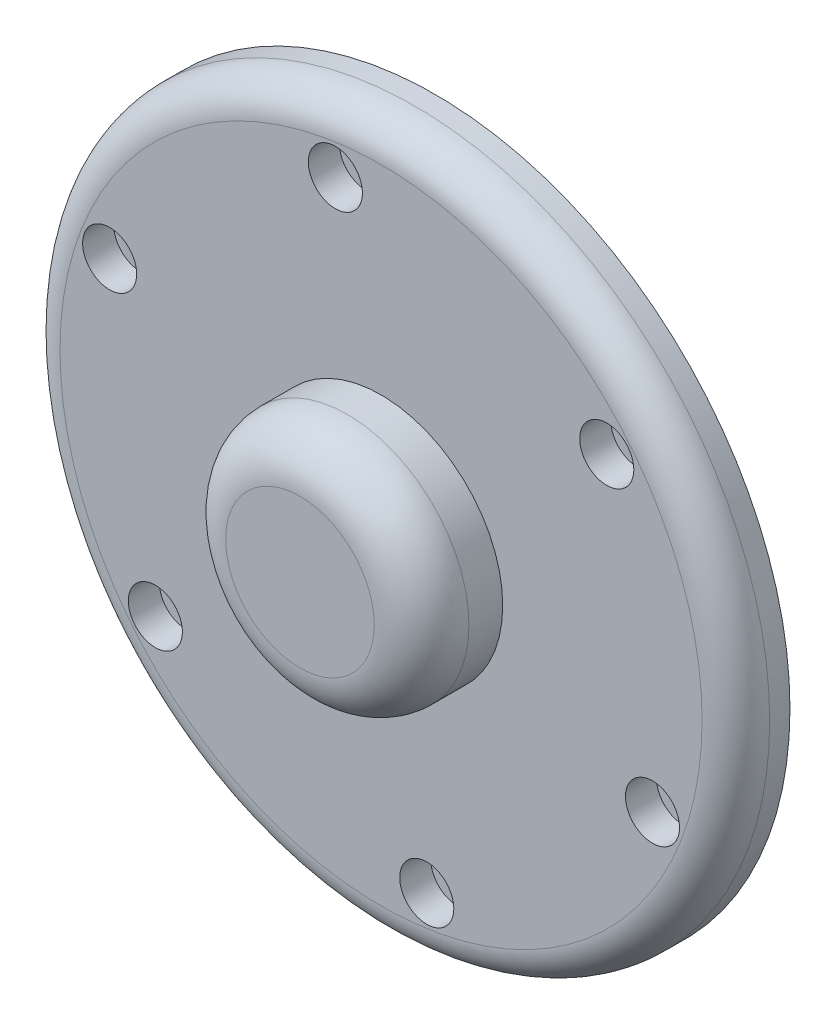
from build123d import *

# Parameters (mm, degrees)
SKETCH_1_R                   = 52.5
EXTRUDE_1_DEPTH              = 20
CUT_EXTRUDE_START            = -12
SKETCH_3_R                   = 52.5
SKETCH_3_R_2                 = 18
CUT_EXTRUDE_1_DEPTH          = 12
SKETCH_5_R                   = 15.25
CUT_EXTRUDE_3_DEPTH          = 17.5
HOLE_WIZARD_M4_1_D           = 4.5
HOLE_WIZARD_M4_1_CBORE_D     = 8
HOLE_WIZARD_M4_1_CBORE_DEPTH = 4.6
PATTERN_CIRCULAR_1_COUNT     = 6
FILLET_2_R                   = 7
FILLET_3_R                   = 5


with BuildPart() as part:
    # 草图1 → 凸台-拉伸1 (new body)
    with BuildSketch(Plane.XY):
        Circle(SKETCH_1_R)
    extrude(amount=EXTRUDE_1_DEPTH)

    # 草图3 → 切除-拉伸1 (cut)
    with BuildSketch(Plane.XY.offset(20).offset(CUT_EXTRUDE_START)):
        Circle(SKETCH_3_R)
        Circle(SKETCH_3_R_2, mode=Mode.SUBTRACT)
    extrude(amount=CUT_EXTRUDE_1_DEPTH, mode=Mode.SUBTRACT)

    # 草图5 → 切除-拉伸3 (cut)
    with BuildSketch(Plane(origin=(0, 0, 0), x_dir=(-1, 0, 0), z_dir=(0, 0, -1))):
        with Locations((0, 0.647267044)):
            Circle(SKETCH_5_R)
    extrude(amount=-CUT_EXTRUDE_3_DEPTH, mode=Mode.SUBTRACT)

    # M4 六角圆柱头螺钉的柱形沉头孔1 (through all)
    with Locations(Plane.XY.offset(8)):
        with Locations((33.394511176, 27.088865302)):
            hole_wizard_m4_1 = CounterBoreHole(HOLE_WIZARD_M4_1_D / 2, HOLE_WIZARD_M4_1_CBORE_D / 2, HOLE_WIZARD_M4_1_CBORE_DEPTH)

    # 阵列(圆周)1: M4 六角圆柱头螺钉的柱形沉头孔1 ×6 about axis
    pattern_circular_1_axis = Axis((0, 0, 20), (0, 0, -1))
    for i in range(1, PATTERN_CIRCULAR_1_COUNT):
        add(hole_wizard_m4_1.rotate(pattern_circular_1_axis, i * 360 / PATTERN_CIRCULAR_1_COUNT), mode=Mode.SUBTRACT)

    # 圆角2
    fillet_2_edges = [part.edges().sort_by_distance(p)[0] for p in [
        (-18, 0, 20),
    ]]
    fillet(fillet_2_edges, radius=FILLET_2_R)

    # 圆角3
    fillet_3_edges = [part.edges().sort_by_distance(p)[0] for p in [
        (-52.5, 0, 8),
    ]]
    fillet(fillet_3_edges, radius=FILLET_3_R)


solid = part.part
